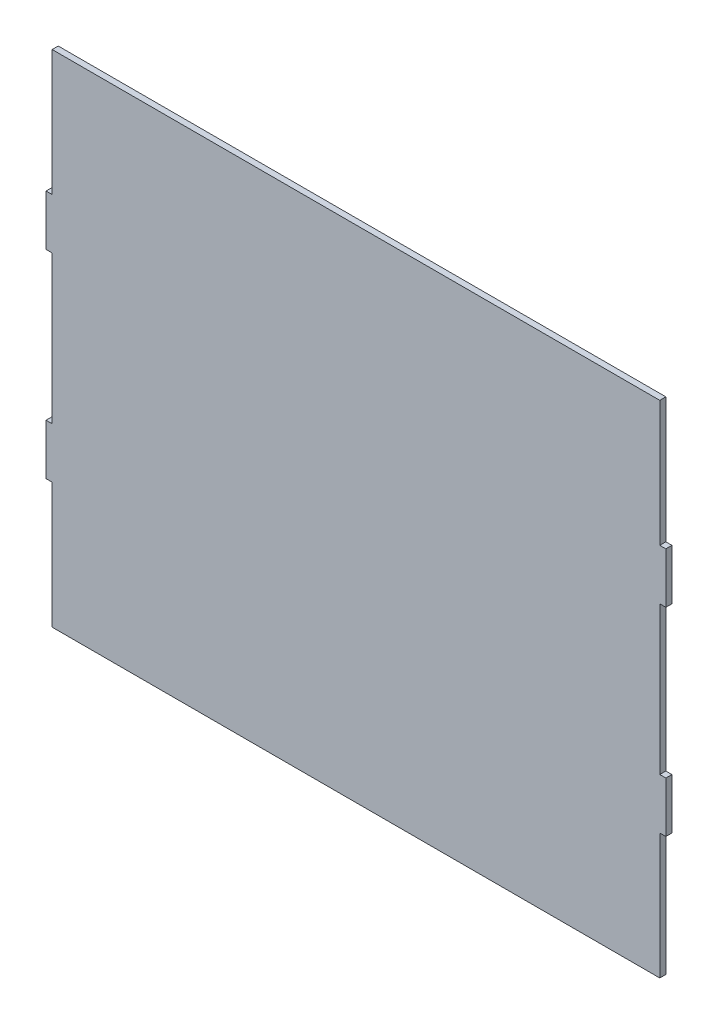
from build123d import *

# Parameters (mm, degrees)
BOSS_EXTRUDE1_DEPTH = 6


with BuildPart() as part:
    # Sketch1 → Boss-Extrude1 (new body)
    with BuildSketch(Plane.XY):
        Polygon((-300, 247), (300, 247), (300, 123), (306, 123), (306, 73), (300, 73), (300, -73), (306, -73), (306, -123), (300, -123), (300, -247), (-300, -247), (-300, -123), (-306, -123), (-306, -73), (-300, -73), (-300, 73), (-306, 73), (-306, 123), (-300, 123), align=None)
    extrude(amount=BOSS_EXTRUDE1_DEPTH)


solid = part.part
